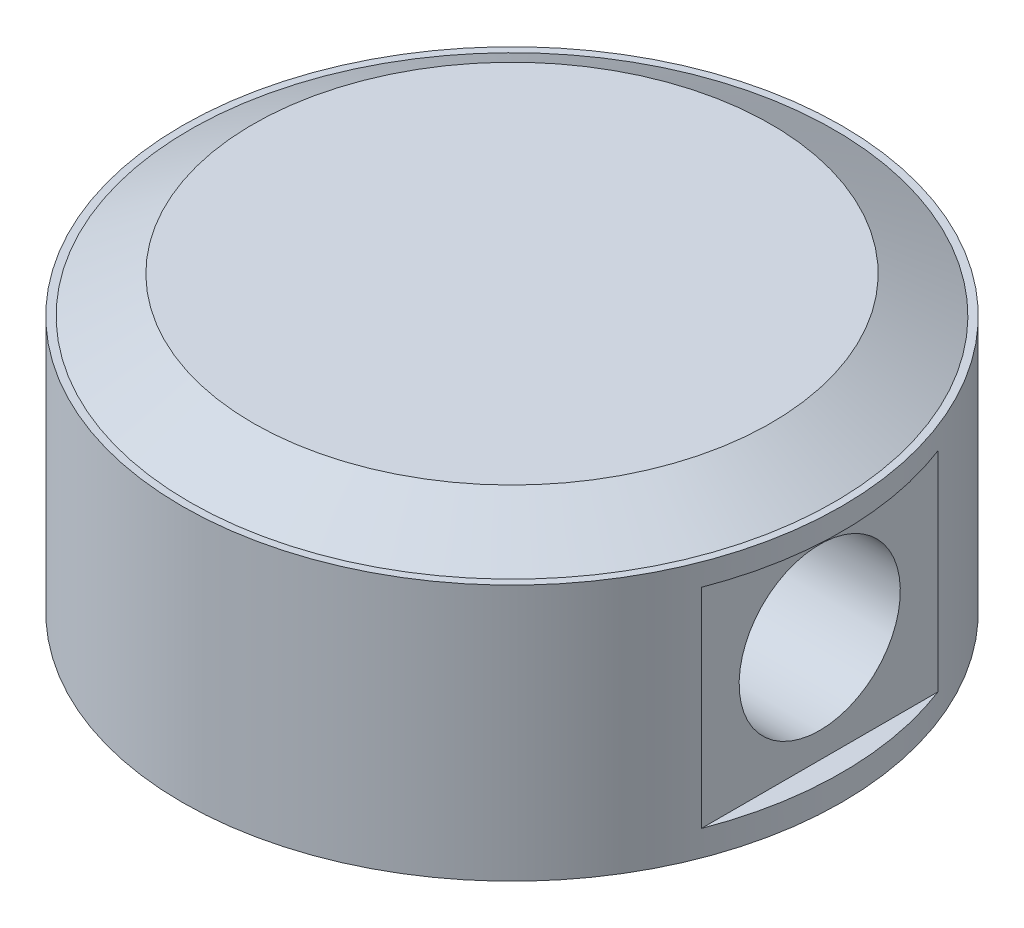
from build123d import *

# Parameters (mm, degrees)
BOSS_EXTRUDE1_REACH     = 77.166
CUT_EXTRUDE1_DEPTH      = 85.369875614
CUT_EXTRUDE1_DEPTH_BACK = 85.369875614
SKETCH6_R               = 11
CUT_EXTRUDE2_DEPTH      = 109.2820393


with BuildPart() as part:
    # Sketch3 → Revolve1 (revolve)
    with BuildSketch(Plane.XY):
        Polygon((0, 0), (0, -5), (23.005029475, -5), (37, -13.08), (37, -23.08), (42, -23.08), (42, -40), (45, -40), (45, -5), (44, -5), (35.339745962, 0), align=None)
    revolve(axis=Axis((0, 0, 0), (0, -1, 0)))

    # Sketch5 → Boss-Extrude1 (add, up to next)
    with BuildSketch(Plane.XZ.offset(40), mode=Mode.PRIVATE) as boss_extrude1_sk1:
        with BuildLine():
            Line((-24.103941586, -38), (-24.103941586, -15))
            Line((-24.103941586, -15), (-14.103941586, -15))
            Line((-14.103941586, -15), (-14.103941586, 15))
            Line((-14.103941586, 15), (-24.103941586, 15))
            Line((-24.103941586, 15), (-24.103941586, 38))
            ThreePointArc((-24.103941586, 38), (-45, 0), (-24.103941586, -38))
        make_face()
    boss_extrude1_tool1 = extrude(boss_extrude1_sk1.sketch, amount=-BOSS_EXTRUDE1_REACH, mode=Mode.PRIVATE) - part.part
    # Sketch5 → Boss-Extrude1 (add, up to next)
    with BuildSketch(Plane.XZ.offset(40), mode=Mode.PRIVATE) as boss_extrude1_sk2:
        with BuildLine():
            Line((24.103941586, 38), (24.103941586, 15))
            Line((24.103941586, 15), (14.103941586, 15))
            Line((14.103941586, 15), (14.103941586, -15))
            Line((14.103941586, -15), (24.103941586, -15))
            Line((24.103941586, -15), (24.103941586, -38))
            ThreePointArc((24.103941586, -38), (45, 0), (24.103941586, 38))
        make_face()
    boss_extrude1_tool2 = extrude(boss_extrude1_sk2.sketch, amount=-BOSS_EXTRUDE1_REACH, mode=Mode.PRIVATE) - part.part
    add(boss_extrude1_tool1.solids().sort_by_distance((-29.792455, -40, 0))[0])
    add(boss_extrude1_tool2.solids().sort_by_distance((29.792455, -40, 0))[0])

    # Sketch6 → Cut-Extrude1 (cut, two sides: drawn at the far end of the back side and taken through both)
    with BuildSketch(Plane(origin=(-14.103941586, 0, 0), x_dir=(0, 0, -1), z_dir=(1, 0, 0)).offset(-CUT_EXTRUDE1_DEPTH_BACK)):
        with Locations((0, -22)):
            Circle(SKETCH6_R)
    extrude(amount=CUT_EXTRUDE1_DEPTH + CUT_EXTRUDE1_DEPTH_BACK, mode=Mode.SUBTRACT)

    # Sketch7 → Cut-Extrude2 (cut, through all)
    with BuildSketch(Plane.XY.offset(45)):
        with BuildLine():
            add(Edge.make_bspline(
                [(-45, -11), (-42.311111111, -22), (-45, -33)],
                knots=[0, 0, 0, 1, 1, 1], degree=2, weights=[0.034, 0.045, 0.056]))
            Line((-45, -33), (-45, -36.499956336))
            Line((-45, -36.499956336), (-42, -36.499956336))
            Line((-42, -36.499956336), (-42, -8))
            Line((-42, -8), (-45, -8))
            Line((-45, -8), (-45, -11))
        make_face()
        with BuildLine():
            Line((42, -36.499956336), (45, -36.499956336))
            Line((45, -36.499956336), (45, -33))
            add(Edge.make_bspline(
                [(45, -33), (42.311111111, -22), (45, -11)],
                knots=[0, 0, 0, 1, 1, 1], degree=2, weights=[0.034, 0.045, 0.056]))
            Line((45, -11), (45, -8))
            Line((45, -8), (42, -8))
            Line((42, -8), (42, -36.499956336))
        make_face()
    extrude(amount=-CUT_EXTRUDE2_DEPTH, mode=Mode.SUBTRACT)


solid = part.part
